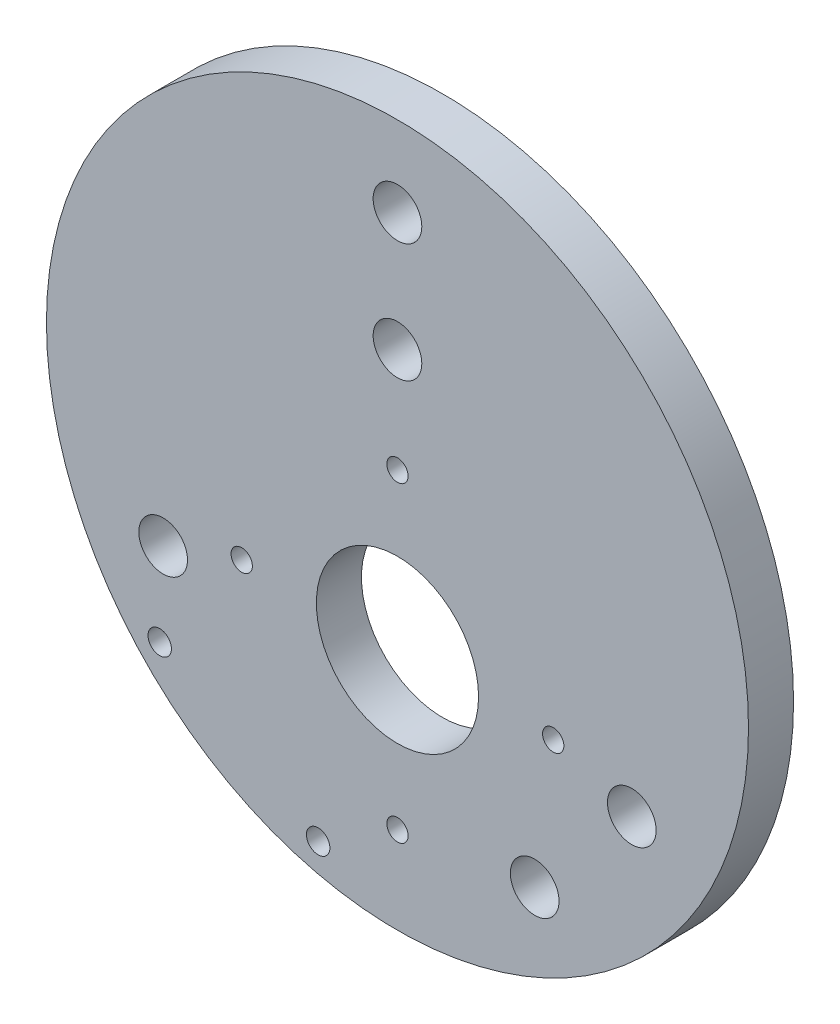
from build123d import *

# Parameters (mm, degrees)
SKETCH1_R                        = 49.4665
BOSS_EXTRUDE1_DEPTH              = 6.35
M3_SCREW_HOLE_3_0MM_DOWEL_HOLE_D = 3
SKETCH6_R                        = 3.429
CUT_EXTRUDE2_DEPTH               = 71.243802179
SKETCH7_R                        = 11.43
CUT_EXTRUDE3_DEPTH               = 71.243802179
SKETCH5_R                        = 3.429
CUT_EXTRUDE4_DEPTH               = 71.243802179
SKETCH11_R                       = 3.429
SKETCH11_R_2                     = 1.651
CUT_EXTRUDE7_DEPTH               = 71.243802179


with BuildPart() as part:
    # Sketch1 → Boss-Extrude1 (new body)
    with BuildSketch(Plane.XY):
        Circle(SKETCH1_R)
    extrude(amount=BOSS_EXTRUDE1_DEPTH)

    # M3 Screw Hole - Ø3.0mm Dowel Hole (through all)
    with Locations(Plane.XY.offset(6.35)):
        with Locations((0, 6.70774596), (-21.94774596, -15.24), (0, -37.18774596), (21.94774596, -15.24)):
            Hole(M3_SCREW_HOLE_3_0MM_DOWEL_HOLE_D / 2)

    # Sketch6 → Cut-Extrude2 (cut, through all)
    with BuildSketch(Plane.XY.offset(6.35)):
        with Locations((0, 38.128211777)):
            Circle(SKETCH6_R)
        with Locations((-33.02, -19.064105889)):
            Circle(SKETCH6_R)
        with Locations((33.02, -19.064105889)):
            Circle(SKETCH6_R)
    extrude(amount=-CUT_EXTRUDE2_DEPTH, mode=Mode.SUBTRACT)

    # Sketch7 → Cut-Extrude3 (cut, through all)
    with BuildSketch(Plane.XY.offset(6.35)):
        with Locations((0, -15.24)):
            Circle(SKETCH7_R)
    extrude(amount=-CUT_EXTRUDE3_DEPTH, mode=Mode.SUBTRACT)

    # Sketch5 → Cut-Extrude4 (cut, through all)
    with BuildSketch(Plane.XY.offset(6.35)):
        with Locations((0, 21.399444974)):
            Circle(SKETCH5_R)
    extrude(amount=-CUT_EXTRUDE4_DEPTH, mode=Mode.SUBTRACT)

    # Sketch11 → Cut-Extrude7 (cut, through all)
    with BuildSketch(Plane.XY.offset(6.35)):
        with Locations((19.337847873, -34.534058078)):
            Circle(SKETCH11_R)
        with Locations((-11.176, -44.186058078)):
            Circle(SKETCH11_R_2)
        with Locations((-33.502470571, -31.042497836)):
            Circle(SKETCH11_R_2)
    extrude(amount=-CUT_EXTRUDE7_DEPTH, mode=Mode.SUBTRACT)


solid = part.part
